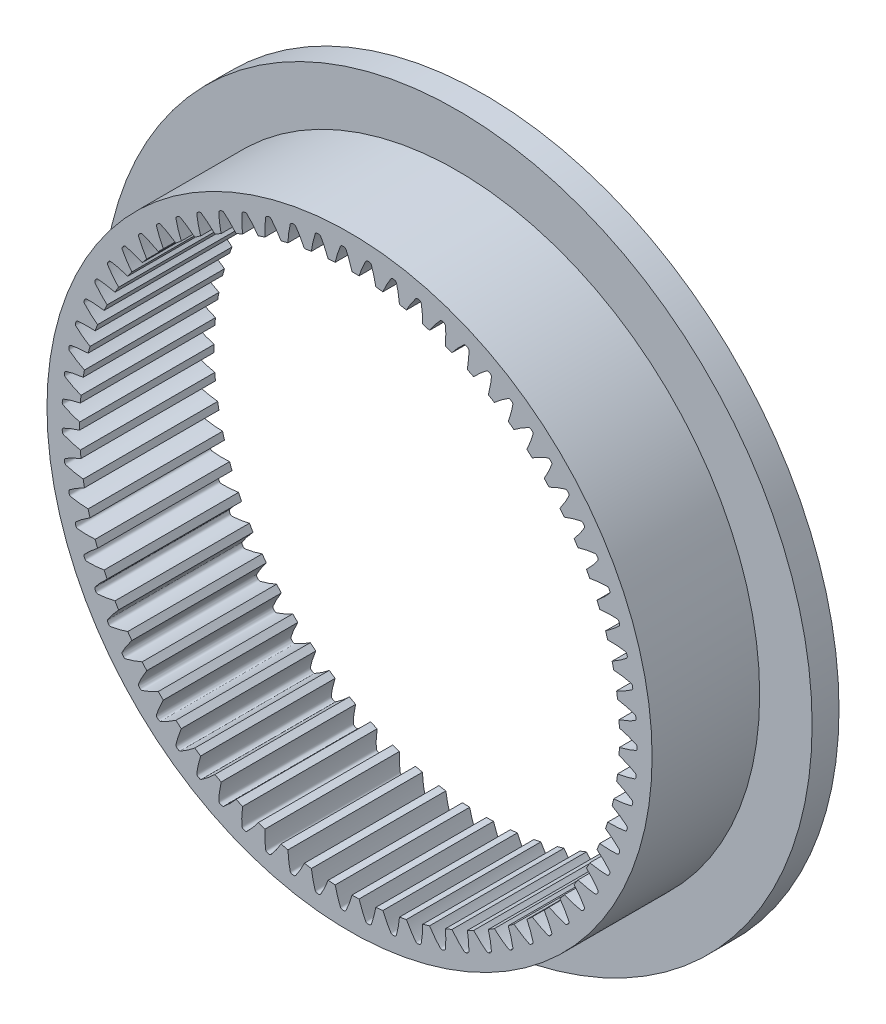
from build123d import *

# Parameters (mm, degrees)
SKETCHREVOLVERING_GEAR_FOLLOWER02_W       = 12.7
SKETCHREVOLVERING_GEAR_FOLLOWER02_H       = 12.605485554
TOOTHEXTRUDECUTRING_GEAR_FOLLOWER02_DEPTH = 6.35
PATTERNRING_GEAR_FOLLOWER02_COUNT         = 71
CUT_EXTRUDE1_START                        = -10.16
SKETCH1_R                                 = 38.1
SKETCH1_R_2                               = 28.575
CUT_EXTRUDE1_DEPTH                        = 10.16
SKETCH2_R                                 = 38.1
SKETCH2_R_2                               = 33.528
CUT_EXTRUDE2_DEPTH                        = 55.831064346


with BuildPart() as part:
    # SketchRevolveRing_Gear_Follower02 → Ring_Gear_Follower02 (revolve)
    with BuildSketch(Plane(origin=(0, 0, 0), x_dir=(0, 0, -1), z_dir=(1, 0, 0))):
        with Locations((0, 31.797257223)):
            Rectangle(SKETCHREVOLVERING_GEAR_FOLLOWER02_W, SKETCHREVOLVERING_GEAR_FOLLOWER02_H)
    revolve(axis=Axis((0, 0, 0), (0, 0, -1)))

    # SketchToothRing_Gear_Follower02 → ToothExtrudeCutRing_Gear_Follower02 (cut, symmetric)
    with BuildSketch(Plane.XY):
        with BuildLine():
            ThreePointArc((25.322927659, -0.82871153), (25.336484129, 0), (25.322927659, 0.82871153))
            add(Edge.make_bspline(
                [(25.322927659, 0.82871153), (25.411193227, 0.810779418), (25.548369787, 0.779641293), (25.73703866, 0.730716025), (25.893719775, 0.686526963), (26.060019661, 0.635793622), (26.235740614, 0.578122954), (26.420601194, 0.512958361), (26.614590985, 0.440440956), (26.816534891, 0.357921841), (26.965603298, 0.299305132), (27.053707916, 0.255658194), (27.07978715, 0.236202557), (27.102676224, 0.213703355), (27.122058774, 0.188078342), (27.137518064, 0.159938095), (27.152567702, 0.120273485), (27.157865815, 0.077173665), (27.157027264, 0.033782392), (27.157286624, 0), (27.157027264, -0.033782392), (27.157865815, -0.077173665), (27.152567702, -0.120273485), (27.137518064, -0.159938095), (27.122058774, -0.188078342), (27.102676224, -0.213703355), (27.07978715, -0.236202557), (27.053707916, -0.255658194), (26.965603298, -0.299305132), (26.816534891, -0.357921841), (26.614590985, -0.440440956), (26.420601194, -0.512958361), (26.235740614, -0.578122954), (26.060019661, -0.635793622), (25.893719775, -0.686526963), (25.73703866, -0.730716025), (25.548369787, -0.779641293), (25.411193227, -0.810779418), (25.322927659, -0.82871153)],
                knots=[0, 0, 0, 0, 0.063805266, 0.099630163, 0.138069903, 0.179124486, 0.222793912, 0.269078181, 0.317977293, 0.369491248, 0.423620045, 0.431437983, 0.438996188, 0.446554392, 0.454112596, 0.4616708, 0.469229004, 0.484048205, 0.492024109, 0.5, 0.507975891, 0.515951795, 0.530770996, 0.5383292, 0.545887404, 0.553445608, 0.561003812, 0.568562017, 0.576379955, 0.630508752, 0.682022707, 0.730921819, 0.777206088, 0.820875514, 0.861930097, 0.900369837, 0.936194734, 1, 1, 1, 1], degree=3))
        make_face()
    toothextrudecutring_gear_follower02 = extrude(amount=TOOTHEXTRUDECUTRING_GEAR_FOLLOWER02_DEPTH, both=True, mode=Mode.SUBTRACT)

    # PatternRing_Gear_Follower02: ToothExtrudeCutRing_Gear_Follower02 ×71 about axis
    patternring_gear_follower02_axis = Axis((0, 0, 55), (0, 0, -1))
    for i in range(1, PATTERNRING_GEAR_FOLLOWER02_COUNT):
        add(toothextrudecutring_gear_follower02.rotate(patternring_gear_follower02_axis, i * 360 / PATTERNRING_GEAR_FOLLOWER02_COUNT), mode=Mode.SUBTRACT)

    # Sketch1 → Cut-Extrude1 (cut)
    with BuildSketch(Plane.XY.offset(6.35).offset(CUT_EXTRUDE1_START)):
        Circle(SKETCH1_R)
        Circle(SKETCH1_R_2, mode=Mode.SUBTRACT)
    extrude(amount=CUT_EXTRUDE1_DEPTH, mode=Mode.SUBTRACT)

    # Sketch2 → Cut-Extrude2 (cut, through all)
    with BuildSketch(Plane.XY.offset(-3.81)):
        Circle(SKETCH2_R)
        Circle(SKETCH2_R_2, mode=Mode.SUBTRACT)
    extrude(amount=-CUT_EXTRUDE2_DEPTH, mode=Mode.SUBTRACT)


solid = part.part
